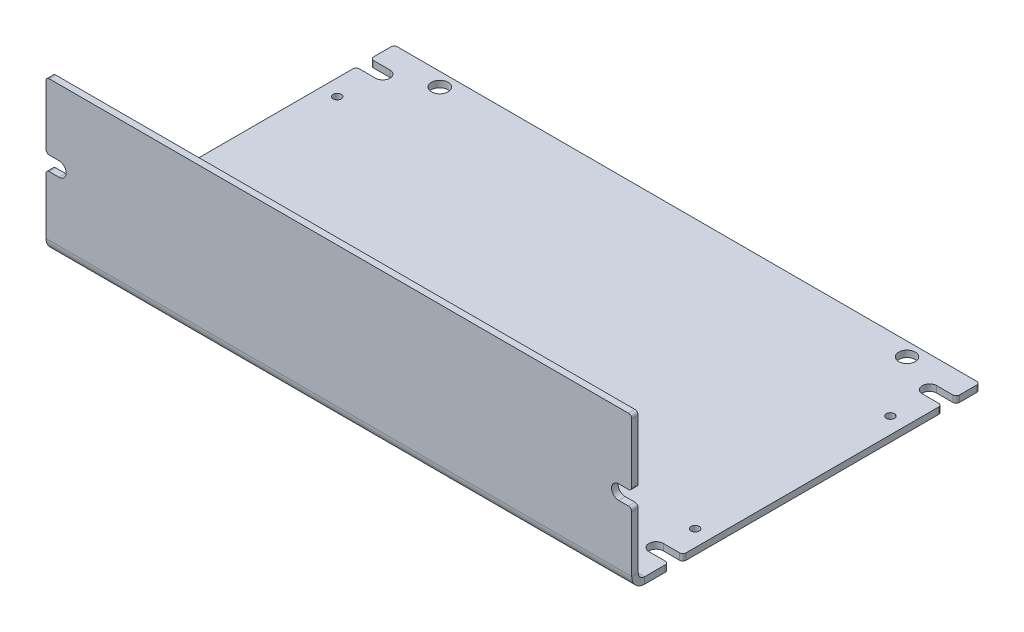
from build123d import *

# Parameters (mm, degrees)
SKETCH1_W                  = 180
SKETCH1_H                  = 103
BASE_FLANGE1_DEPTH         = 2
EDGE_FLANGE1_DEPTH         = 180
EDGE_FLANGE1_START         = 2
EDGE_FLANGE1_FLAT_DEPTH    = 2
F_5_1_5_1_DIAMETER_HOLE1_D = 5.1
LPATTERN1_COUNT            = 2
LPATTERN1_PITCH            = 143.6
LPATTERN1_COUNT_DIR2       = 2
LPATTERN1_PITCH_DIR2       = 93.6
M3_TAPPED_HOLE1_D          = 2.5
CUT_EXTRUDE1_DEPTH         = 115.914098352
FILLET1_R                  = 1
BODY_MOVE_COPY1_ANGLE      = 180


# Sheet-metal steps are written as plain solids
with BuildPart() as part:
    # Sketch1 → Base-Flange1 (new body)
    with BuildSketch(Plane(origin=(0, 0, 0), x_dir=(1, 0, 0), z_dir=(0, 1, 0))):
        Rectangle(SKETCH1_W, SKETCH1_H)
    extrude(amount=-BASE_FLANGE1_DEPTH)

    # Edge-Flange1 bend section (across the edge) → Edge-Flange1 (add)
    with BuildSketch(Plane(origin=(90, 0, -53.5), x_dir=(0, 0, 1), z_dir=(-1, 0, 0))):
        with BuildLine():
            Line((-2, 2), (0, 2))
            ThreePointArc((0, 2), (0.585786438, 0.585786438), (2, 0))
            Line((2, 0), (2, -2))
            ThreePointArc((2, -2), (-0.828427125, -0.828427125), (-2, 2))
        make_face()
    extrude(amount=EDGE_FLANGE1_DEPTH)

    # Edge-Flange1 profile (on flange) → Edge-Flange1 flat (add)
    with BuildSketch(Plane(origin=(0, 0, -53.5), x_dir=(-1, 0, 0), z_dir=(0, 0, -1)).offset(EDGE_FLANGE1_START)):
        with BuildLine():
            ThreePointArc((86, 20.3), (83.8, 22.5), (86, 24.7))
            Line((86, 24.7), (90, 24.7))
            Line((90, 24.7), (90, 45))
            Line((90, 45), (-90, 45))
            Line((-90, 45), (-90, 24.7))
            Line((-90, 24.7), (-86, 24.7))
            ThreePointArc((-86, 24.7), (-83.8, 22.5), (-86, 20.3))
            Line((-86, 20.3), (-90, 20.3))
            Line((-90, 20.3), (-90, 2))
            Line((-90, 2), (90, 2))
            Line((90, 2), (90, 20.3))
            Line((90, 20.3), (86, 20.3))
        make_face()
    extrude(amount=-EDGE_FLANGE1_FLAT_DEPTH)

    # Ø5.1 (5.1) Diameter Hole1 (through all)
    with Locations(Plane(origin=(0, -2, 0), x_dir=(-1, 0, 0), z_dir=(0, -1, 0))):
        with Locations((-71.8, -47.3)):
            f_5_1_5_1_diameter_hole1 = Hole(F_5_1_5_1_DIAMETER_HOLE1_D / 2)

    # LPattern1: 5.1 _5.1_ Diameter Hole1 2 × 2
    with Locations(*[(-i * LPATTERN1_PITCH, 0, -j * LPATTERN1_PITCH_DIR2) for i in range(LPATTERN1_COUNT) for j in range(LPATTERN1_COUNT_DIR2) if (i, j) != (0, 0)]):
        add(f_5_1_5_1_diameter_hole1, mode=Mode.SUBTRACT)

    # M3 Tapped Hole1 (through all)
    with Locations(Plane(origin=(0, 0, 0), x_dir=(1, 0, 0), z_dir=(0, 1, 0))):
        with Locations((-85, -29), (85, -29), (-85, 31), (85, 31)):
            Hole(M3_TAPPED_HOLE1_D / 2)

    # Sketch13 → Cut-Extrude1 (cut, through all)
    with BuildSketch(Plane(origin=(0, 0, 0), x_dir=(1, 0, 0), z_dir=(0, 1, 0))):
        with BuildLine():
            Line((-90, 44.2), (-84, 44.2))
            ThreePointArc((-84, 44.2), (-81.8, 42), (-84, 39.8))
            Line((-84, 39.8), (-90, 39.8))
            Line((-90, 39.8), (-90, 44.2))
        make_face()
        with BuildLine():
            Line((-90, -39.8), (-90, -44.2))
            Line((-90, -44.2), (-84, -44.2))
            ThreePointArc((-84, -44.2), (-81.8, -42), (-84, -39.8))
            Line((-84, -39.8), (-90, -39.8))
        make_face()
        with BuildLine():
            Line((90, -44.2), (84, -44.2))
            ThreePointArc((84, -44.2), (81.8, -42), (84, -39.8))
            Line((84, -39.8), (90, -39.8))
            Line((90, -39.8), (90, -44.2))
        make_face()
        with BuildLine():
            Line((90, 39.8), (90, 44.2))
            Line((90, 44.2), (84, 44.2))
            ThreePointArc((84, 44.2), (81.8, 42), (84, 39.8))
            Line((84, 39.8), (90, 39.8))
        make_face()
    extrude(amount=-CUT_EXTRUDE1_DEPTH, mode=Mode.SUBTRACT)

    # Fillet1
    fillet1_edges = [part.edges().sort_by_distance(p)[0] for p in [
        (90, -1, -44.2),
        (90, -1, -39.8),
        (90, -1, 39.8),
        (90, -1, 44.2),
        (-90, -1, 44.2),
        (-90, -1, 39.8),
        (-90, -1, -39.8),
        (-90, -1, -44.2),
        (90, 20.3, -54.5),
        (-90, 20.3, -54.5),
        (-90, 24.7, -54.5),
        (-90, 45, -54.5),
        (90, 45, -54.5),
        (90, 24.7, -54.5),
        (90, -1, 51.5),
        (-90, -1, 51.5),
    ]]
    fillet(fillet1_edges, radius=FILLET1_R)


with BuildPart() as part_1:
    # Body-Move/Copy1: moved
    add(part.part.rotate(Axis((0, 0, 0), (0, 1, 0)), BODY_MOVE_COPY1_ANGLE))


solid = part_1.part
